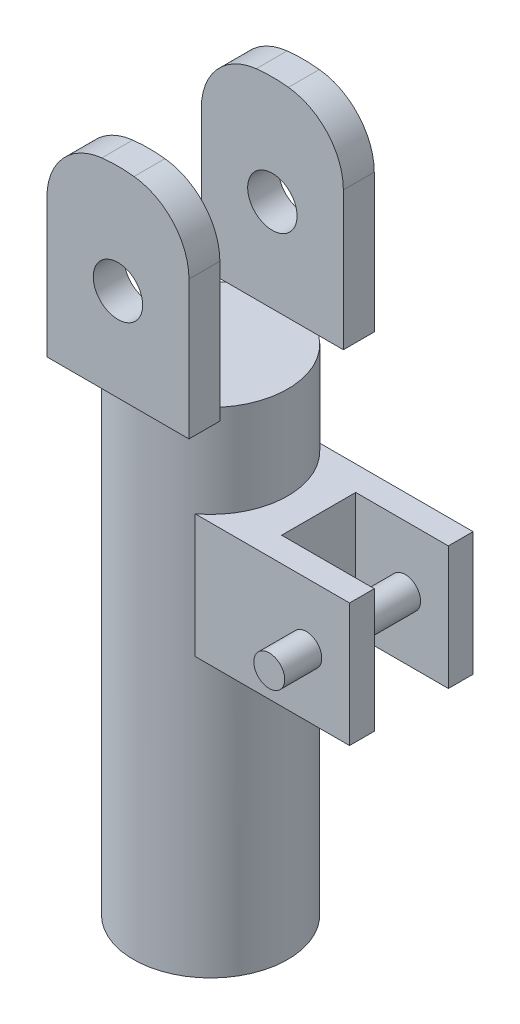
from build123d import *

# Parameters (mm, degrees)
SKETCH1_R                = 12.5
BOSS_EXTRUDE1_DEPTH      = 35
SKETCH3_R                = 4
BOSS_EXTRUDE2_DEPTH      = 15
SKETCH4_R                = 10
CUT_EXTRUDE1_DEPTH       = 30
SKETCH5_W                = 20
SKETCH5_H                = 32.5
CUT_EXTRUDE2_DEPTH       = 74.193237393
BOSS_EXTRUDE3_START      = 45
SKETCH6_R                = 12.5
SKETCH6_R_2              = 10
BOSS_EXTRUDE3_DEPTH      = 45
SKETCH9_W                = 19
SKETCH9_H                = 20
BOSS_EXTRUDE6_DEPTH      = 10
BOSS_EXTRUDE7_REACH      = 75.873
SKETCH10_W               = 20
SKETCH10_H               = 20
SKETCH11_W               = 15
SKETCH11_H               = 12
CUT_EXTRUDE3_DEPTH       = 20
CUT_EXTRUDE4_DEPTH       = 78.80424153
CUT_EXTRUDE4_DEPTH_BACK  = 78.80424153
SKETCH12_R               = 2.5
BOSS_EXTRUDE8_DEPTH      = 20
BOSS_EXTRUDE8_DEPTH_BACK = 10
SKETCH13_R               = 2.5


with BuildPart() as part:
    # Sketch1 → Boss-Extrude1 (new body)
    with BuildSketch(Plane(origin=(0, 0, 0), x_dir=(1, 0, 0), z_dir=(0, 1, 0))):
        Circle(SKETCH1_R)
    extrude(amount=BOSS_EXTRUDE1_DEPTH)

    # Sketch3 → Boss-Extrude2 (add, symmetric)
    with BuildSketch(Plane.XY):
        with BuildLine():
            Line((-11.5, 35), (11.5, 35))
            Line((11.5, 35), (11.5, 57.416666667))
            ThreePointArc((11.5, 57.416666667), (8.952413135, 64.084615261), (2.607692308, 67.355128205))
            ThreePointArc((2.607692308, 67.355128205), (0, 67.5), (-2.607692308, 67.355128205))
            ThreePointArc((-2.607692308, 67.355128205), (-8.952413135, 64.084615261), (-11.5, 57.416666667))
            Line((-11.5, 57.416666667), (-11.5, 35))
        make_face()
        with Locations((0, 50)):
            Circle(SKETCH3_R, mode=Mode.SUBTRACT)
    extrude(amount=BOSS_EXTRUDE2_DEPTH, both=True)

    # Sketch4 → Cut-Extrude1 (cut)
    with BuildSketch(Plane.XZ):
        Circle(SKETCH4_R)
    extrude(amount=-CUT_EXTRUDE1_DEPTH, mode=Mode.SUBTRACT)

    # Sketch5 → Cut-Extrude2 (cut, through all)
    with BuildSketch(Plane(origin=(11.5, 0, 0), x_dir=(0, 0, -1), z_dir=(1, 0, 0))):
        with Locations((0, 51.25)):
            Rectangle(SKETCH5_W, SKETCH5_H)
    extrude(amount=-CUT_EXTRUDE2_DEPTH, mode=Mode.SUBTRACT)

    # Sketch6 → Boss-Extrude3 (add)
    with BuildSketch(Plane.XZ.offset(BOSS_EXTRUDE3_START)):
        Circle(SKETCH6_R)
        Circle(SKETCH6_R_2, mode=Mode.SUBTRACT)
    extrude(amount=-BOSS_EXTRUDE3_DEPTH)

    # Sketch10 → Boss-Extrude7 (add, up to next)
    with BuildSketch(Plane.ZY.offset(-13.5), mode=Mode.PRIVATE) as boss_extrude7_sk1:
        with Locations((0, 10)):
            Rectangle(SKETCH10_W, SKETCH10_H)
    boss_extrude7_tool1 = extrude(boss_extrude7_sk1.sketch, amount=BOSS_EXTRUDE7_REACH, mode=Mode.PRIVATE) - part.part


with BuildPart() as body_2:
    # Sketch9 → Boss-Extrude6 (new, symmetric)
    with BuildSketch(Plane.XY):
        with Locations((23, 10)):
            Rectangle(SKETCH9_W, SKETCH9_H)
    extrude(amount=BOSS_EXTRUDE6_DEPTH, both=True)


with BuildPart() as part_1:
    add(part.part)

    add(body_2.part)  # Boss-Extrude7 merges body 2
    add(boss_extrude7_tool1.solids().sort_by_distance((13.5, 10, 0))[0])

    # Sketch11 → Cut-Extrude3 (cut)
    with BuildSketch(Plane(origin=(0, 20, 0), x_dir=(1, 0, 0), z_dir=(0, 1, 0))):
        with Locations((25, 0)):
            Rectangle(SKETCH11_W, SKETCH11_H)
    extrude(amount=-CUT_EXTRUDE3_DEPTH, mode=Mode.SUBTRACT)

    # Sketch12 → Cut-Extrude4 (cut, two sides: drawn at the far end of the back side and taken through both)
    with BuildSketch(Plane.XY.offset(-6).offset(-CUT_EXTRUDE4_DEPTH_BACK)):
        with Locations((25.5, 10)):
            Circle(SKETCH12_R)
    extrude(amount=CUT_EXTRUDE4_DEPTH + CUT_EXTRUDE4_DEPTH_BACK, mode=Mode.SUBTRACT)

    # Sketch13 → Boss-Extrude8 (add, two sides: drawn at the far end of the back side and taken through both)
    with BuildSketch(Plane(origin=(0, 0, 6), x_dir=(-1, 0, 0), z_dir=(0, 0, -1)).offset(-BOSS_EXTRUDE8_DEPTH_BACK)):
        with Locations((-25.5, 10)):
            Circle(SKETCH13_R)
    extrude(amount=BOSS_EXTRUDE8_DEPTH + BOSS_EXTRUDE8_DEPTH_BACK)


solid = part_1.part
